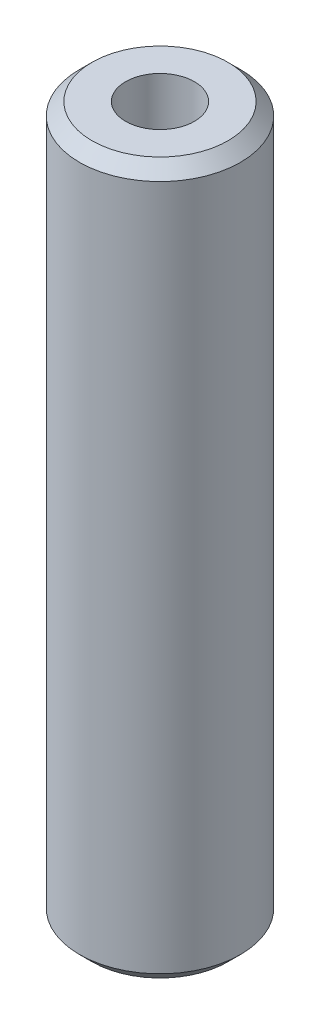
from build123d import *

# Parameters (mm, degrees)
SKETCH1_R           = 37.5
BOSS_EXTRUDE1_DEPTH = 331.331739578
SKETCH2_R           = 16.036157314
CUT_EXTRUDE1_DEPTH  = 336.549134482
CHAMFER1_SIZE       = 5.8125639


with BuildPart() as part:
    # Sketch1 → Boss-Extrude1 (new body)
    with BuildSketch(Plane(origin=(0, 0, 0), x_dir=(1, 0, 0), z_dir=(0, 1, 0))):
        Circle(SKETCH1_R)
    extrude(amount=BOSS_EXTRUDE1_DEPTH)

    # Sketch2 → Cut-Extrude1 (cut, through all)
    with BuildSketch(Plane(origin=(0, 0, 0), x_dir=(1, 0, 0), z_dir=(0, 1, 0))):
        Circle(SKETCH2_R)
    extrude(amount=CUT_EXTRUDE1_DEPTH, mode=Mode.SUBTRACT)

    # Chamfer1
    chamfer1_edges = [part.edges().sort_by_distance(p)[0] for p in [
        (-37.5, 331.331739578, 0),
        (-37.5, 0, 0),
    ]]
    chamfer(chamfer1_edges, length=CHAMFER1_SIZE)


solid = part.part
